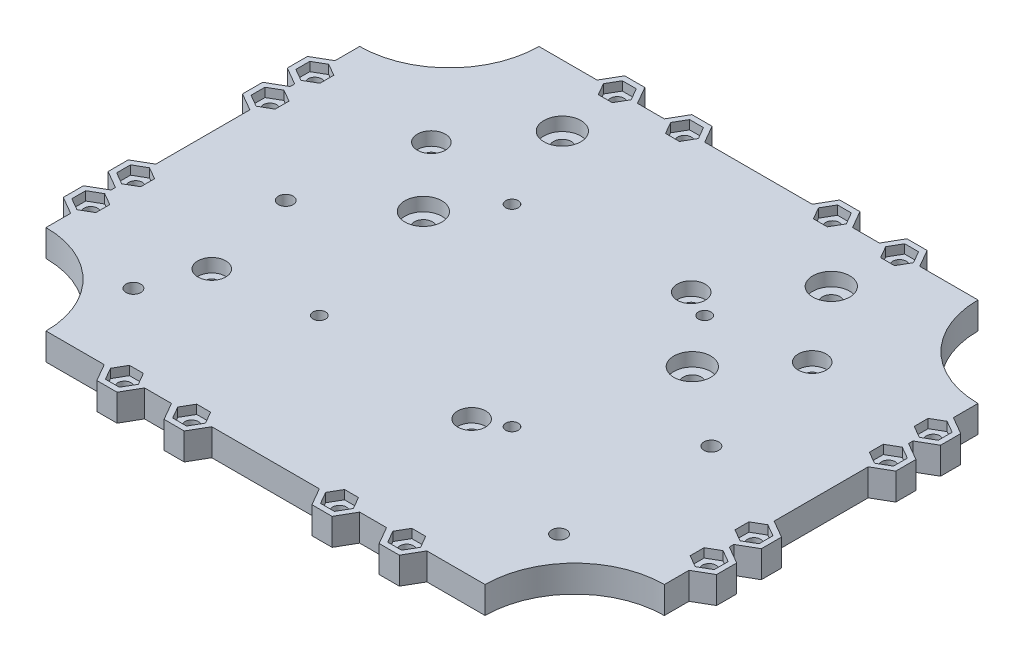
from build123d import *
from build123d.topology import SkipClean

# Parameters (mm, degrees)
SALIENTE_EXTRUIR2_DEPTH          = 6
CORTAR_EXTRUIR1_DEPTH            = 2
CORTAR_EXTRUIR2_DEPTH            = 2
CROQUIS5_R                       = 1.5
CORTAR_EXTRUIR3_DEPTH            = 2
CROQUIS7_R                       = 1.65
CORTAR_EXTRUIR4_DEPTH            = 10
CORTAR_EXTRUIR9_DEPTH            = 10
S_LIDO_MOVER_COPIAR1_OUTLINE_R   = 1.5
S_LIDO_MOVER_COPIAR1_OUTLINE_R_2 = 1.65
S_LIDO_MOVER_COPIAR1_DEPTH       = 6
S_LIDO_MOVER_COPIAR1_2_OUTLINE_R = 1.5
S_LIDO_MOVER_COPIAR1_2_DEPTH     = 2
S_LIDO_MOVER_COPIAR1_START       = 4
S_LIDO_MOVER_COPIAR1_3_OUTLINE_R = 1.5
S_LIDO_MOVER_COPIAR1_3_DEPTH     = 2
S_LIDO_MOVER_COPIAR1_4_OUTLINE_W = 12
S_LIDO_MOVER_COPIAR1_4_OUTLINE_H = 110
S_LIDO_MOVER_COPIAR1_4_OUTLINE_R = 1.65
S_LIDO_MOVER_COPIAR1_4_DEPTH     = 6
S_LIDO_MOVER_COPIAR1_START_2     = 2
S_LIDO_MOVER_COPIAR1_5_DEPTH     = 2
CROQUIS9_R                       = 4.125
CORTAR_EXTRUIR10_DEPTH           = 3
CROQUIS10_R                      = 2
CORTAR_EXTRUIR11_DEPTH           = 4
CROQUIS12_R                      = 3.125
CORTAR_EXTRUIR12_DEPTH           = 3
CROQUIS13_R                      = 1.5
CORTAR_EXTRUIR13_DEPTH           = 3
CROQUIS14_R                      = 1.4
CORTAR_EXTRUIR14_DEPTH           = 13


# Read off the part's stored shape, not the designer's step: Sólido-Mover/Copiar1
with BuildPart() as part:
    # Croquis1 → Saliente-Extruir2 (new body)
    with BuildSketch(Plane(origin=(0, 0, 0), x_dir=(1, 0, 0), z_dir=(0, 1, 0))):
        with BuildLine():
            Line((75, 20.5), (75, 29.5))
            Line((75, 29.5), (75, 35))
            ThreePointArc((75, 35), (60.857864376, 40.857864376), (55, 55))
            Line((55, 55), (42, 55))
            Line((42, 55), (33, 55))
            Line((33, 55), (27, 55))
            Line((27, 55), (18, 55))
            Line((18, 55), (0, 55))
            Line((0, 55), (-18, 55))
            Line((-18, 55), (-27, 55))
            Line((-27, 55), (-33, 55))
            Line((-33, 55), (-42, 55))
            Line((-42, 55), (-55, 55))
            ThreePointArc((-55, 55), (-60.857864376, 40.857864376), (-75, 35))
            Line((-75, 35), (-75, 29.5))
            Line((-75, 29.5), (-75, 20.5))
            Line((-75, 20.5), (-75, 19.5))
            Line((-75, 19.5), (-75, 10.5))
            Line((-75, 10.5), (-75, 0))
            Line((-75, 0), (-75, -10.5))
            Line((-75, -10.5), (-75, -19.5))
            Line((-75, -19.5), (-75, -20.5))
            Line((-75, -20.5), (-75, -29.5))
            Line((-75, -29.5), (-75, -35))
            ThreePointArc((-75, -35), (-60.857864376, -40.857864376), (-55, -55))
            Line((-55, -55), (-42, -55))
            Line((-42, -55), (-33, -55))
            Line((-33, -55), (-27, -55))
            Line((-27, -55), (-18, -55))
            Line((-18, -55), (0, -55))
            Line((0, -55), (18, -55))
            Line((18, -55), (27, -55))
            Line((27, -55), (33, -55))
            Line((33, -55), (42, -55))
            Line((42, -55), (55, -55))
            ThreePointArc((55, -55), (60.857864376, -40.857864376), (75, -35))
            Line((75, -35), (75, -29.5))
            Line((75, -29.5), (75, -20.5))
            Line((75, -20.5), (75, -19.5))
            Line((75, -19.5), (75, -10.5))
            Line((75, -10.5), (75, 0))
            Line((75, 0), (75, 10.5))
            Line((75, 10.5), (75, 19.5))
            Line((75, 19.5), (75, 20.5))
        make_face()
        Polygon((-39.75, 58.897114317), (-42, 55), (-33, 55), (-35.25, 58.897114317), align=None)
        Polygon((-24.75, 58.897114317), (-27, 55), (-18, 55), (-20.25, 58.897114317), align=None)
        Polygon((27, 55), (18, 55), (20.25, 58.897114317), (24.75, 58.897114317), align=None)
        Polygon((42, 55), (33, 55), (35.25, 58.897114317), (39.75, 58.897114317), align=None)
        Polygon((75, 20.5), (75, 29.5), (78.897114317, 27.25), (78.897114317, 22.75), align=None)
        Polygon((75, 10.5), (75, 19.5), (78.897114317, 17.25), (78.897114317, 12.75), align=None)
        Polygon((78.897114317, -12.75), (75, -10.5), (75, -19.5), (78.897114317, -17.25), align=None)
        Polygon((78.897114317, -22.75), (75, -20.5), (75, -29.5), (78.897114317, -27.25), align=None)
        Polygon((39.75, -58.897114317), (42, -55), (33, -55), (35.25, -58.897114317), align=None)
        Polygon((24.75, -58.897114317), (27, -55), (18, -55), (20.25, -58.897114317), align=None)
        Polygon((-42, -55), (-33, -55), (-35.25, -58.897114317), (-39.75, -58.897114317), align=None)
        Polygon((-18, -55), (-20.25, -58.897114317), (-24.75, -58.897114317), (-27, -55), align=None)
        Polygon((-75, -29.5), (-78.897114317, -27.25), (-78.897114317, -22.75), (-75, -20.5), align=None)
        Polygon((-75, -19.5), (-78.897114317, -17.25), (-78.897114317, -12.75), (-75, -10.5), align=None)
        Polygon((-78.897114317, 12.75), (-75, 10.5), (-75, 19.5), (-78.897114317, 17.25), align=None)
        Polygon((-78.897114317, 22.75), (-75, 20.5), (-75, 29.5), (-78.897114317, 27.25), align=None)
    extrude(amount=SALIENTE_EXTRUIR2_DEPTH)

    # Croquis2 → Cortar-Extruir1 (cut)
    with BuildSketch(Plane(origin=(0, 6, 0), x_dir=(1, 0, 0), z_dir=(0, 1, 0))):
        Polygon((-34.4, 55), (-35.95, 57.684678752), (-39.05, 57.684678752), (-40.6, 55), (-39.05, 52.315321248), (-35.95, 52.315321248), align=None)
        Polygon((-19.4, 55), (-20.95, 57.684678752), (-24.05, 57.684678752), (-25.6, 55), (-24.05, 52.315321248), (-20.95, 52.315321248), align=None)
        Polygon((20.95, 52.315321248), (19.4, 55), (20.95, 57.684678752), (24.05, 57.684678752), (25.6, 55), (24.05, 52.315321248), align=None)
        Polygon((35.95, 52.315321248), (34.4, 55), (35.95, 57.684678752), (39.05, 57.684678752), (40.6, 55), (39.05, 52.315321248), align=None)
        Polygon((39.05, -52.315321248), (35.95, -52.315321248), (34.4, -55), (35.95, -57.684678752), (39.05, -57.684678752), (40.6, -55), align=None)
        Polygon((24.05, -52.315321248), (20.95, -52.315321248), (19.4, -55), (20.95, -57.684678752), (24.05, -57.684678752), (25.6, -55), align=None)
        Polygon((-20.95, -52.315321248), (-19.4, -55), (-20.95, -57.684678752), (-24.05, -57.684678752), (-25.6, -55), (-24.05, -52.315321248), align=None)
        Polygon((-35.95, -52.315321248), (-34.4, -55), (-35.95, -57.684678752), (-39.05, -57.684678752), (-40.6, -55), (-39.05, -52.315321248), align=None)
        Polygon((75, 21.9), (77.684678752, 23.45), (77.684678752, 26.55), (75, 28.1), (72.315321248, 26.55), (72.315321248, 23.45), align=None)
        Polygon((-72.315321248, 23.45), (-75, 21.9), (-77.684678752, 23.45), (-77.684678752, 26.55), (-75, 28.1), (-72.315321248, 26.55), align=None)
        Polygon((75, 11.9), (77.684678752, 13.45), (77.684678752, 16.55), (75, 18.1), (72.315321248, 16.55), (72.315321248, 13.45), align=None)
        Polygon((-72.315321248, 13.45), (-75, 11.9), (-77.684678752, 13.45), (-77.684678752, 16.55), (-75, 18.1), (-72.315321248, 16.55), align=None)
        Polygon((72.315321248, -13.45), (75, -11.9), (77.684678752, -13.45), (77.684678752, -16.55), (75, -18.1), (72.315321248, -16.55), align=None)
        Polygon((72.315321248, -23.45), (75, -21.9), (77.684678752, -23.45), (77.684678752, -26.55), (75, -28.1), (72.315321248, -26.55), align=None)
        Polygon((-72.315321248, -16.55), (-72.315321248, -13.45), (-75, -11.9), (-77.684678752, -13.45), (-77.684678752, -16.55), (-75, -18.1), align=None)
        Polygon((-72.315321248, -26.55), (-72.315321248, -23.45), (-75, -21.9), (-77.684678752, -23.45), (-77.684678752, -26.55), (-75, -28.1), align=None)
    extrude(amount=-CORTAR_EXTRUIR1_DEPTH, mode=Mode.SUBTRACT)

    # Croquis3 → Cortar-Extruir2 (cut)
    with BuildSketch(Plane.XZ):
        Polygon((-34.4, 55), (-35.95, 57.684678752), (-39.05, 57.684678752), (-40.6, 55), (-39.05, 52.315321248), (-35.95, 52.315321248), align=None)
        Polygon((-19.4, 55), (-20.95, 57.684678752), (-24.05, 57.684678752), (-25.6, 55), (-24.05, 52.315321248), (-20.95, 52.315321248), align=None)
        Polygon((-35.95, -52.315321248), (-34.4, -55), (-35.95, -57.684678752), (-39.05, -57.684678752), (-40.6, -55), (-39.05, -52.315321248), align=None)
        Polygon((-20.95, -52.315321248), (-19.4, -55), (-20.95, -57.684678752), (-24.05, -57.684678752), (-25.6, -55), (-24.05, -52.315321248), align=None)
        Polygon((24.05, -52.315321248), (20.95, -52.315321248), (19.4, -55), (20.95, -57.684678752), (24.05, -57.684678752), (25.6, -55), align=None)
        Polygon((39.05, -52.315321248), (35.95, -52.315321248), (34.4, -55), (35.95, -57.684678752), (39.05, -57.684678752), (40.6, -55), align=None)
        Polygon((20.95, 52.315321248), (19.4, 55), (20.95, 57.684678752), (24.05, 57.684678752), (25.6, 55), (24.05, 52.315321248), align=None)
        Polygon((35.95, 52.315321248), (34.4, 55), (35.95, 57.684678752), (39.05, 57.684678752), (40.6, 55), (39.05, 52.315321248), align=None)
        Polygon((75, 21.9), (77.684678752, 23.45), (77.684678752, 26.55), (75, 28.1), (72.315321248, 26.55), (72.315321248, 23.45), align=None)
        Polygon((72.315321248, -23.45), (75, -21.9), (77.684678752, -23.45), (77.684678752, -26.55), (75, -28.1), (72.315321248, -26.55), align=None)
        Polygon((75, 11.9), (77.684678752, 13.45), (77.684678752, 16.55), (75, 18.1), (72.315321248, 16.55), (72.315321248, 13.45), align=None)
        Polygon((72.315321248, -13.45), (75, -11.9), (77.684678752, -13.45), (77.684678752, -16.55), (75, -18.1), (72.315321248, -16.55), align=None)
        Polygon((-72.315321248, -16.55), (-72.315321248, -13.45), (-75, -11.9), (-77.684678752, -13.45), (-77.684678752, -16.55), (-75, -18.1), align=None)
        Polygon((-72.315321248, -26.55), (-72.315321248, -23.45), (-75, -21.9), (-77.684678752, -23.45), (-77.684678752, -26.55), (-75, -28.1), align=None)
        Polygon((-72.315321248, 13.45), (-75, 11.9), (-77.684678752, 13.45), (-77.684678752, 16.55), (-75, 18.1), (-72.315321248, 16.55), align=None)
        Polygon((-72.315321248, 23.45), (-75, 21.9), (-77.684678752, 23.45), (-77.684678752, 26.55), (-75, 28.1), (-72.315321248, 26.55), align=None)
    extrude(amount=-CORTAR_EXTRUIR2_DEPTH, mode=Mode.SUBTRACT)

    # Croquis5 → Cortar-Extruir3 (cut)
    with BuildSketch(Plane(origin=(0, 4, 0), x_dir=(1, 0, 0), z_dir=(0, 1, 0))):
        with Locations(Location((-37.5, 55, 0), (0, 0, 270))):
            Circle(CROQUIS5_R)
        with Locations(Location((-22.5, 55, 0), (0, 0, 270))):
            Circle(CROQUIS5_R)
        with Locations(Location((22.5, 55, 0), (0, 0, 90))):
            Circle(CROQUIS5_R)
        with Locations(Location((37.5, 55, 0), (0, 0, 90))):
            Circle(CROQUIS5_R)
        with Locations(Location((22.5, -55, 0), (0, 0, 270))):
            Circle(CROQUIS5_R)
        with Locations(Location((37.5, -55, 0), (0, 0, 270))):
            Circle(CROQUIS5_R)
        with Locations(Location((-22.5, -55, 0), (0, 0, 90))):
            Circle(CROQUIS5_R)
        with Locations(Location((-37.5, -55, 0), (0, 0, 90))):
            Circle(CROQUIS5_R)
        with Locations(Location((75, 25, 0), (0, 0, 270))):
            Circle(CROQUIS5_R)
        with Locations(Location((75, 15, 0), (0, 0, 270))):
            Circle(CROQUIS5_R)
        with Locations(Location((75, -15, 0), (0, 0, 90))):
            Circle(CROQUIS5_R)
        with Locations(Location((75, -25, 0), (0, 0, 90))):
            Circle(CROQUIS5_R)
        with Locations(Location((-75, -25, 0), (0, 0, 270))):
            Circle(CROQUIS5_R)
        with Locations(Location((-75, -15, 0), (0, 0, 270))):
            Circle(CROQUIS5_R)
        with Locations(Location((-75, 15, 0), (0, 0, 90))):
            Circle(CROQUIS5_R)
        with Locations(Location((-75, 25, 0), (0, 0, 90))):
            Circle(CROQUIS5_R)
    extrude(amount=-CORTAR_EXTRUIR3_DEPTH, mode=Mode.SUBTRACT)

    # Croquis7 → Cortar-Extruir4 (cut)
    with BuildSketch(Plane(origin=(0, 6, 0), x_dir=(1, 0, 0), z_dir=(0, 1, 0))):
        with Locations(Location((-53.5, -37, 0), (0, 0, 270))):
            Circle(CROQUIS7_R)
        with Locations(Location((-53.5, -3, 0), (0, 0, 270))):
            Circle(CROQUIS7_R)
        with Locations(Location((53.5, -37, 0), (0, 0, 270))):
            Circle(CROQUIS7_R)
        with Locations(Location((53.5, -3, 0), (0, 0, 270))):
            Circle(CROQUIS7_R)
    extrude(amount=-CORTAR_EXTRUIR4_DEPTH, mode=Mode.SUBTRACT)

    # Croquis8 → Cortar-Extruir9 (cut)
    with BuildSketch(Plane(origin=(0, 6, 0), x_dir=(1, 0, 0), z_dir=(0, 1, 0))):
        Polygon((0, 55), (6, 55), (6, -55), (-6, -55), (-6, 55), align=None)
    extrude(amount=-CORTAR_EXTRUIR9_DEPTH, mode=Mode.SUBTRACT)


with BuildPart() as cortar_extruir9_piece_1:
    # of the separate pieces the step leaves, piece 1, a body of its own (cortar_extruir9_pieces)
    add(part.part.solids().sort_by_distance((75, 0, 35))[0])

    # Sólido-Mover/Copiar1 outline → Sólido-Mover/Copiar1 (cut)
    # profile 1 of 15: a face of its own
    with BuildSketch(Plane(origin=(0, 0, 0), x_dir=(1, 0, 0), z_dir=(0, 1, 0))):
        with BuildLine():
            ThreePointArc((12, -55), (10.5, -53.5), (9, -55))
            Line((9, -55), (12, -55))
        make_face()
    # profile 2 of 15: a face of its own
    with BuildSketch(Plane(origin=(0, 0, 0), x_dir=(1, 0, 0), z_dir=(0, 1, 0))):
        with BuildLine():
            Line((12, 55), (9, 55))
            ThreePointArc((9, 55), (10.5, 53.5), (12, 55))
        make_face()
    # profile 3 of 15: a face of its own
    with BuildSketch(Plane(origin=(0, 0, 0), x_dir=(1, 0, 0), z_dir=(0, 1, 0))):
        with BuildLine():
            Line((18, -55), (20.25, -58.897114317))
            Line((20.25, -58.897114317), (23.25, -58.897114317))
            Line((23.25, -58.897114317), (21.75, -56.299038106))
            ThreePointArc((21.75, -56.299038106), (21.200961894, -55.75), (21, -55))
            Line((21, -55), (18, -55))
        make_face()
    # profile 4 of 15: a face of its own
    with BuildSketch(Plane(origin=(0, 0, 0), x_dir=(1, 0, 0), z_dir=(0, 1, 0))):
        with BuildLine():
            Line((20.25, 58.897114317), (18, 55))
            Line((18, 55), (21, 55))
            ThreePointArc((21, 55), (21.200961894, 55.75), (21.75, 56.299038106))
            Line((21.75, 56.299038106), (23.25, 58.897114317))
            Line((23.25, 58.897114317), (20.25, 58.897114317))
        make_face()
    # profile 5 of 15: a face of its own
    with BuildSketch(Plane(origin=(0, 0, 0), x_dir=(1, 0, 0), z_dir=(0, 1, 0))):
        with BuildLine():
            Line((26.25, -56.299038106), (27, -55))
            ThreePointArc((27, -55), (24.200961894, -54.25), (26.25, -56.299038106))
        make_face()
    # profile 6 of 15: a face of its own
    with BuildSketch(Plane(origin=(0, 0, 0), x_dir=(1, 0, 0), z_dir=(0, 1, 0))):
        with BuildLine():
            Line((27, 55), (26.25, 56.299038106))
            ThreePointArc((26.25, 56.299038106), (24.200961894, 54.25), (27, 55))
        make_face()
    # profile 7 of 15: a face of its own
    with BuildSketch(Plane(origin=(0, 0, 0), x_dir=(1, 0, 0), z_dir=(0, 1, 0))):
        with BuildLine():
            Line((33, -55), (35.25, -58.897114317))
            Line((35.25, -58.897114317), (39.75, -58.897114317))
            Line((39.75, -58.897114317), (42, -55))
            Line((42, -55), (39, -55))
            ThreePointArc((39, -55), (37.5, -56.5), (36, -55))
            Line((36, -55), (33, -55))
        make_face()
    # profile 8 of 15: a face of its own
    with BuildSketch(Plane(origin=(0, 0, 0), x_dir=(1, 0, 0), z_dir=(0, 1, 0))):
        with BuildLine():
            Line((35.25, 58.897114317), (33, 55))
            Line((33, 55), (36, 55))
            ThreePointArc((36, 55), (37.5, 56.5), (39, 55))
            Line((39, 55), (42, 55))
            Line((42, 55), (39.75, 58.897114317))
            Line((39.75, 58.897114317), (35.25, 58.897114317))
        make_face()
    # profile 9 of 15: a face of its own
    with BuildSketch(Plane(origin=(0, 0, 0), x_dir=(1, 0, 0), z_dir=(0, 1, 0))):
        with BuildLine():
            ThreePointArc((52.282739333, -38.113901463), (45.473659633, -45.365302634), (43, -55))
            Line((43, -55), (55, -55))
            ThreePointArc((55, -55), (60.857864376, -40.857864376), (75, -35))
            Line((75, -35), (75, -29.5))
            Line((75, -29.5), (78.897114317, -27.25))
            Line((78.897114317, -27.25), (78.897114317, -22.75))
            Line((78.897114317, -22.75), (75, -20.5))
            Line((75, -20.5), (75, -19.5))
            Line((75, -19.5), (78.897114317, -17.25))
            Line((78.897114317, -17.25), (78.897114317, -12.75))
            Line((78.897114317, -12.75), (75, -10.5))
            Line((75, -10.5), (75, 10.5))
            Line((75, 10.5), (78.897114317, 12.75))
            Line((78.897114317, 12.75), (78.897114317, 17.25))
            Line((78.897114317, 17.25), (75, 19.5))
            Line((75, 19.5), (75, 20.5))
            Line((75, 20.5), (78.897114317, 22.75))
            Line((78.897114317, 22.75), (78.897114317, 27.25))
            Line((78.897114317, 27.25), (75, 29.5))
            Line((75, 29.5), (75, 35))
            ThreePointArc((75, 35), (60.857864376, 40.857864376), (55, 55))
            Line((55, 55), (43, 55))
            ThreePointArc((43, 55), (48.857864376, 40.857864376), (63, 35))
            Line((63, 35), (63, 29.5))
            Line((63, 29.5), (66.897114317, 27.25))
            Line((66.897114317, 27.25), (66.897114317, 22.75))
            Line((66.897114317, 22.75), (63, 20.5))
            Line((63, 20.5), (63, 19.5))
            Line((63, 19.5), (66.897114317, 17.25))
            Line((66.897114317, 17.25), (66.897114317, 12.75))
            Line((66.897114317, 12.75), (63, 10.5))
            Line((63, 10.5), (63, -10.5))
            Line((63, -10.5), (66.897114317, -12.75))
            Line((66.897114317, -12.75), (66.897114317, -17.25))
            Line((66.897114317, -17.25), (63, -19.5))
            Line((63, -19.5), (63, -20.5))
            Line((63, -20.5), (66.897114317, -22.75))
            Line((66.897114317, -22.75), (66.897114317, -27.25))
            Line((66.897114317, -27.25), (63, -29.5))
            Line((63, -29.5), (63, -35))
            ThreePointArc((63, -35), (58.970622907, -35.410101576), (55.106491204, -36.623587975))
            ThreePointArc((55.106491204, -36.623587975), (54.270151722, -38.459234842), (52.282739333, -38.113901463))
        make_face()
        with Locations((75, -25)):
            Circle(S_LIDO_MOVER_COPIAR1_OUTLINE_R, mode=Mode.SUBTRACT)
        with Locations((75, -15)):
            Circle(S_LIDO_MOVER_COPIAR1_OUTLINE_R, mode=Mode.SUBTRACT)
        with Locations((75, 15)):
            Circle(S_LIDO_MOVER_COPIAR1_OUTLINE_R, mode=Mode.SUBTRACT)
        with Locations((75, 25)):
            Circle(S_LIDO_MOVER_COPIAR1_OUTLINE_R, mode=Mode.SUBTRACT)
    # profile 10 of 15: a face of its own
    with BuildSketch(Plane(origin=(0, 0, 0), x_dir=(1, 0, 0), z_dir=(0, 1, 0))):
        with Locations((63, -25)):
            Circle(S_LIDO_MOVER_COPIAR1_OUTLINE_R)
    # profile 11 of 15: a face of its own
    with BuildSketch(Plane(origin=(0, 0, 0), x_dir=(1, 0, 0), z_dir=(0, 1, 0))):
        with Locations((63, 25)):
            Circle(S_LIDO_MOVER_COPIAR1_OUTLINE_R)
    # profile 12 of 15: a face of its own
    with BuildSketch(Plane(origin=(0, 0, 0), x_dir=(1, 0, 0), z_dir=(0, 1, 0))):
        with Locations((63, -15)):
            Circle(S_LIDO_MOVER_COPIAR1_OUTLINE_R)
    # profile 13 of 15: a face of its own
    with BuildSketch(Plane(origin=(0, 0, 0), x_dir=(1, 0, 0), z_dir=(0, 1, 0))):
        with Locations((63, 15)):
            Circle(S_LIDO_MOVER_COPIAR1_OUTLINE_R)
    # profile 14 of 15: a face of its own
    with BuildSketch(Plane(origin=(0, 0, 0), x_dir=(1, 0, 0), z_dir=(0, 1, 0))):
        with Locations((41.5, -37)):
            Circle(S_LIDO_MOVER_COPIAR1_OUTLINE_R_2)
    # profile 15 of 15: a face of its own
    with BuildSketch(Plane(origin=(0, 0, 0), x_dir=(1, 0, 0), z_dir=(0, 1, 0))):
        with Locations((41.5, -3)):
            Circle(S_LIDO_MOVER_COPIAR1_OUTLINE_R_2)
    extrude(amount=S_LIDO_MOVER_COPIAR1_DEPTH, mode=Mode.SUBTRACT)

    # S_lido-Mover_Copiar1 2 outline → S_lido-Mover_Copiar1 2 (cut)
    # profile 1 of 10: a face of its own
    with BuildSketch(Plane(origin=(0, 0, 0), x_dir=(1, 0, 0), z_dir=(0, 1, 0))):
        with BuildLine():
            Line((8.95, -52.315321248), (7.4, -55))
            Line((7.4, -55), (9, -55))
            ThreePointArc((9, -55), (10.5, -53.5), (12, -55))
            Line((12, -55), (13.6, -55))
            Line((13.6, -55), (12.05, -52.315321248))
            Line((12.05, -52.315321248), (8.95, -52.315321248))
        make_face()
    # profile 2 of 10: a face of its own
    with BuildSketch(Plane(origin=(0, 0, 0), x_dir=(1, 0, 0), z_dir=(0, 1, 0))):
        with BuildLine():
            Line((9, 55), (7.4, 55))
            Line((7.4, 55), (8.95, 52.315321248))
            Line((8.95, 52.315321248), (12.05, 52.315321248))
            Line((12.05, 52.315321248), (13.6, 55))
            Line((13.6, 55), (12, 55))
            ThreePointArc((12, 55), (10.5, 53.5), (9, 55))
        make_face()
    # profile 3 of 10: a face of its own
    with BuildSketch(Plane(origin=(0, 0, 0), x_dir=(1, 0, 0), z_dir=(0, 1, 0))):
        with BuildLine():
            Line((27.05, -52.315321248), (24.05, -52.315321248))
            Line((24.05, -52.315321248), (24.826251043, -53.659827495))
            ThreePointArc((24.826251043, -53.659827495), (26.287202822, -53.723163394), (27, -55))
            Line((27, -55), (28.6, -55))
            Line((28.6, -55), (27.05, -52.315321248))
        make_face()
    # profile 4 of 10: a face of its own
    with BuildSketch(Plane(origin=(0, 0, 0), x_dir=(1, 0, 0), z_dir=(0, 1, 0))):
        with BuildLine():
            Line((24.05, -57.684678752), (25.45, -57.684678752))
            Line((25.45, -57.684678752), (26.25, -56.299038106))
            ThreePointArc((26.25, -56.299038106), (25.543319339, -56.499374348), (24.826251043, -56.340172505))
            Line((24.826251043, -56.340172505), (24.05, -57.684678752))
        make_face()
    # profile 5 of 10: a face of its own
    with BuildSketch(Plane(origin=(0, 0, 0), x_dir=(1, 0, 0), z_dir=(0, 1, 0))):
        with BuildLine():
            Line((24.826251043, 53.659827495), (24.05, 52.315321248))
            Line((24.05, 52.315321248), (27.05, 52.315321248))
            Line((27.05, 52.315321248), (28.6, 55))
            Line((28.6, 55), (27, 55))
            ThreePointArc((27, 55), (26.287202822, 53.723163394), (24.826251043, 53.659827495))
        make_face()
    # profile 6 of 10: a face of its own
    with BuildSketch(Plane(origin=(0, 0, 0), x_dir=(1, 0, 0), z_dir=(0, 1, 0))):
        with BuildLine():
            Line((26.25, 56.299038106), (25.45, 57.684678752))
            Line((25.45, 57.684678752), (24.05, 57.684678752))
            Line((24.05, 57.684678752), (24.826251043, 56.340172505))
            ThreePointArc((24.826251043, 56.340172505), (25.543319339, 56.499374348), (26.25, 56.299038106))
        make_face()
    # profile 7 of 10: a face of its own
    with BuildSketch(Plane(origin=(0, 0, 0), x_dir=(1, 0, 0), z_dir=(0, 1, 0))):
        Polygon((63, -11.9), (60.315321248, -13.45), (60.315321248, -16.55), (63, -18.1), (65.684678752, -16.55), (65.684678752, -13.45), align=None)
        with Locations((63, -15)):
            Circle(S_LIDO_MOVER_COPIAR1_2_OUTLINE_R, mode=Mode.SUBTRACT)
    # profile 8 of 10: a face of its own
    with BuildSketch(Plane(origin=(0, 0, 0), x_dir=(1, 0, 0), z_dir=(0, 1, 0))):
        Polygon((63, 18.1), (60.315321248, 16.55), (60.315321248, 13.45), (63, 11.9), (65.684678752, 13.45), (65.684678752, 16.55), align=None)
        with Locations((63, 15)):
            Circle(S_LIDO_MOVER_COPIAR1_2_OUTLINE_R, mode=Mode.SUBTRACT)
    # profile 9 of 10: a face of its own
    with BuildSketch(Plane(origin=(0, 0, 0), x_dir=(1, 0, 0), z_dir=(0, 1, 0))):
        Polygon((63, -21.9), (60.315321248, -23.45), (60.315321248, -26.55), (63, -28.1), (65.684678752, -26.55), (65.684678752, -23.45), align=None)
        with Locations((63, -25)):
            Circle(S_LIDO_MOVER_COPIAR1_2_OUTLINE_R, mode=Mode.SUBTRACT)
    # profile 10 of 10: a face of its own
    with BuildSketch(Plane(origin=(0, 0, 0), x_dir=(1, 0, 0), z_dir=(0, 1, 0))):
        Polygon((63, 28.1), (60.315321248, 26.55), (60.315321248, 23.45), (63, 21.9), (65.684678752, 23.45), (65.684678752, 26.55), align=None)
        with Locations((63, 25)):
            Circle(S_LIDO_MOVER_COPIAR1_2_OUTLINE_R, mode=Mode.SUBTRACT)
    extrude(amount=S_LIDO_MOVER_COPIAR1_2_DEPTH, mode=Mode.SUBTRACT)

    # S_lido-Mover_Copiar1 3 outline → S_lido-Mover_Copiar1 3 (cut)
    # profile 1 of 10: a face of its own
    with BuildSketch(Plane(origin=(0, 0, 0), x_dir=(1, 0, 0), z_dir=(0, 1, 0)).offset(S_LIDO_MOVER_COPIAR1_START)):
        with BuildLine():
            Line((8.95, -52.315321248), (7.4, -55))
            Line((7.4, -55), (9, -55))
            ThreePointArc((9, -55), (10.5, -53.5), (12, -55))
            Line((12, -55), (13.6, -55))
            Line((13.6, -55), (12.05, -52.315321248))
            Line((12.05, -52.315321248), (8.95, -52.315321248))
        make_face()
    # profile 2 of 10: a face of its own
    with BuildSketch(Plane(origin=(0, 0, 0), x_dir=(1, 0, 0), z_dir=(0, 1, 0)).offset(S_LIDO_MOVER_COPIAR1_START)):
        with BuildLine():
            Line((9, 55), (7.4, 55))
            Line((7.4, 55), (8.95, 52.315321248))
            Line((8.95, 52.315321248), (12.05, 52.315321248))
            Line((12.05, 52.315321248), (13.6, 55))
            Line((13.6, 55), (12, 55))
            ThreePointArc((12, 55), (10.5, 53.5), (9, 55))
        make_face()
    # profile 3 of 10: a face of its own
    with BuildSketch(Plane(origin=(0, 0, 0), x_dir=(1, 0, 0), z_dir=(0, 1, 0)).offset(S_LIDO_MOVER_COPIAR1_START)):
        with BuildLine():
            Line((27.05, -52.315321248), (24.05, -52.315321248))
            Line((24.05, -52.315321248), (24.826251043, -53.659827495))
            ThreePointArc((24.826251043, -53.659827495), (26.287202822, -53.723163394), (27, -55))
            Line((27, -55), (28.6, -55))
            Line((28.6, -55), (27.05, -52.315321248))
        make_face()
    # profile 4 of 10: a face of its own
    with BuildSketch(Plane(origin=(0, 0, 0), x_dir=(1, 0, 0), z_dir=(0, 1, 0)).offset(S_LIDO_MOVER_COPIAR1_START)):
        with BuildLine():
            Line((24.05, -57.684678752), (25.45, -57.684678752))
            Line((25.45, -57.684678752), (26.25, -56.299038106))
            ThreePointArc((26.25, -56.299038106), (25.543319339, -56.499374348), (24.826251043, -56.340172505))
            Line((24.826251043, -56.340172505), (24.05, -57.684678752))
        make_face()
    # profile 5 of 10: a face of its own
    with BuildSketch(Plane(origin=(0, 0, 0), x_dir=(1, 0, 0), z_dir=(0, 1, 0)).offset(S_LIDO_MOVER_COPIAR1_START)):
        with BuildLine():
            Line((24.826251043, 53.659827495), (24.05, 52.315321248))
            Line((24.05, 52.315321248), (27.05, 52.315321248))
            Line((27.05, 52.315321248), (28.6, 55))
            Line((28.6, 55), (27, 55))
            ThreePointArc((27, 55), (26.287202822, 53.723163394), (24.826251043, 53.659827495))
        make_face()
    # profile 6 of 10: a face of its own
    with BuildSketch(Plane(origin=(0, 0, 0), x_dir=(1, 0, 0), z_dir=(0, 1, 0)).offset(S_LIDO_MOVER_COPIAR1_START)):
        with BuildLine():
            Line((26.25, 56.299038106), (25.45, 57.684678752))
            Line((25.45, 57.684678752), (24.05, 57.684678752))
            Line((24.05, 57.684678752), (24.826251043, 56.340172505))
            ThreePointArc((24.826251043, 56.340172505), (25.543319339, 56.499374348), (26.25, 56.299038106))
        make_face()
    # profile 7 of 10: a face of its own
    with BuildSketch(Plane(origin=(0, 0, 0), x_dir=(1, 0, 0), z_dir=(0, 1, 0)).offset(S_LIDO_MOVER_COPIAR1_START)):
        Polygon((63, -11.9), (60.315321248, -13.45), (60.315321248, -16.55), (63, -18.1), (65.684678752, -16.55), (65.684678752, -13.45), align=None)
        with Locations((63, -15)):
            Circle(S_LIDO_MOVER_COPIAR1_3_OUTLINE_R, mode=Mode.SUBTRACT)
    # profile 8 of 10: a face of its own
    with BuildSketch(Plane(origin=(0, 0, 0), x_dir=(1, 0, 0), z_dir=(0, 1, 0)).offset(S_LIDO_MOVER_COPIAR1_START)):
        Polygon((63, 18.1), (60.315321248, 16.55), (60.315321248, 13.45), (63, 11.9), (65.684678752, 13.45), (65.684678752, 16.55), align=None)
        with Locations((63, 15)):
            Circle(S_LIDO_MOVER_COPIAR1_3_OUTLINE_R, mode=Mode.SUBTRACT)
    # profile 9 of 10: a face of its own
    with BuildSketch(Plane(origin=(0, 0, 0), x_dir=(1, 0, 0), z_dir=(0, 1, 0)).offset(S_LIDO_MOVER_COPIAR1_START)):
        Polygon((63, -21.9), (60.315321248, -23.45), (60.315321248, -26.55), (63, -28.1), (65.684678752, -26.55), (65.684678752, -23.45), align=None)
        with Locations((63, -25)):
            Circle(S_LIDO_MOVER_COPIAR1_3_OUTLINE_R, mode=Mode.SUBTRACT)
    # profile 10 of 10: a face of its own
    with BuildSketch(Plane(origin=(0, 0, 0), x_dir=(1, 0, 0), z_dir=(0, 1, 0)).offset(S_LIDO_MOVER_COPIAR1_START)):
        Polygon((63, 28.1), (60.315321248, 26.55), (60.315321248, 23.45), (63, 21.9), (65.684678752, 23.45), (65.684678752, 26.55), align=None)
        with Locations((63, 25)):
            Circle(S_LIDO_MOVER_COPIAR1_3_OUTLINE_R, mode=Mode.SUBTRACT)
    extrude(amount=S_LIDO_MOVER_COPIAR1_3_DEPTH, mode=Mode.SUBTRACT)

    # S_lido-Mover_Copiar1 4 outline → S_lido-Mover_Copiar1 4 (add)
    with BuildSketch(Plane(origin=(0, 0, 0), x_dir=(1, 0, 0), z_dir=(0, 1, 0))):
        Polygon((7.4, -55), (6, -55), (8.25, -58.897114317), (12.75, -58.897114317), (15, -55), (13.6, -55), (12.05, -57.684678752), (8.95, -57.684678752), align=None)
        Rectangle(S_LIDO_MOVER_COPIAR1_4_OUTLINE_W, S_LIDO_MOVER_COPIAR1_4_OUTLINE_H)
        Polygon((8.25, 58.897114317), (6, 55), (7.4, 55), (8.95, 57.684678752), (12.05, 57.684678752), (13.6, 55), (15, 55), (12.75, 58.897114317), align=None)
        Polygon((20.95, -52.315321248), (19.4, -55), (21, -55), (22.55, -57.684678752), (23.95, -57.684678752), (22.4, -55), (23.95, -52.315321248), align=None)
        Polygon((21, 55), (19.4, 55), (20.95, 52.315321248), (23.95, 52.315321248), (22.4, 55), (23.95, 57.684678752), (22.55, 57.684678752), align=None)
        Polygon((25.45, -57.684678752), (24.75, -58.897114317), (27.75, -58.897114317), (30, -55), (28.6, -55), (27.05, -57.684678752), align=None)
        Polygon((27.75, 58.897114317), (24.75, 58.897114317), (25.45, 57.684678752), (27.05, 57.684678752), (28.6, 55), (30, 55), align=None)
        Polygon((35.95, -52.315321248), (34.4, -55), (40.6, -55), (39.05, -52.315321248), align=None)
        Polygon((34.4, 55), (35.95, 52.315321248), (39.05, 52.315321248), (40.6, 55), align=None)
        with BuildLine():
            ThreePointArc((55.106491204, -36.623587975), (52.729848278, -35.540765158), (52.282739333, -38.113901463))
            ThreePointArc((52.282739333, -38.113901463), (53.664827609, -37.312304943), (55.106491204, -36.623587975))
        make_face()
        with Locations((53.5, -3)):
            Circle(S_LIDO_MOVER_COPIAR1_4_OUTLINE_R)
    extrude(amount=S_LIDO_MOVER_COPIAR1_4_DEPTH)

    # S_lido-Mover_Copiar1 5 outline → S_lido-Mover_Copiar1 5 (add)
    with SkipClean():  # the faces are left unmerged after this step: merging them gives an invalid solid
        with BuildSketch(Plane(origin=(0, 0, 0), x_dir=(1, 0, 0), z_dir=(0, 1, 0)).offset(S_LIDO_MOVER_COPIAR1_START_2)):
            with BuildLine():
                Line((9, -55), (7.4, -55))
                Line((7.4, -55), (8.95, -57.684678752))
                Line((8.95, -57.684678752), (12.05, -57.684678752))
                Line((12.05, -57.684678752), (13.6, -55))
                Line((13.6, -55), (12, -55))
                ThreePointArc((12, -55), (10.5, -56.5), (9, -55))
            make_face()
            with BuildLine():
                Line((8.95, 57.684678752), (7.4, 55))
                Line((7.4, 55), (9, 55))
                ThreePointArc((9, 55), (10.5, 56.5), (12, 55))
                Line((12, 55), (13.6, 55))
                Line((13.6, 55), (12.05, 57.684678752))
                Line((12.05, 57.684678752), (8.95, 57.684678752))
            make_face()
            with BuildLine():
                ThreePointArc((23.173748957, -56.340172505), (24, -55), (23.173748957, -53.659827495))
                Line((23.173748957, -53.659827495), (22.4, -55))
                Line((22.4, -55), (23.173748957, -56.340172505))
            make_face()
            with BuildLine():
                Line((26.25, -56.299038106), (25.45, -57.684678752))
                Line((25.45, -57.684678752), (27.05, -57.684678752))
                Line((27.05, -57.684678752), (28.6, -55))
                Line((28.6, -55), (27, -55))
                ThreePointArc((27, -55), (26.799038106, -55.75), (26.25, -56.299038106))
            make_face()
            with BuildLine():
                Line((22.4, 55), (23.173748957, 53.659827495))
                ThreePointArc((23.173748957, 53.659827495), (24, 55), (23.173748957, 56.340172505))
                Line((23.173748957, 56.340172505), (22.4, 55))
            make_face()
            with BuildLine():
                Line((27.05, 57.684678752), (25.45, 57.684678752))
                Line((25.45, 57.684678752), (26.25, 56.299038106))
                ThreePointArc((26.25, 56.299038106), (26.799038106, 55.75), (27, 55))
                Line((27, 55), (28.6, 55))
                Line((28.6, 55), (27.05, 57.684678752))
            make_face()
        extrude(amount=S_LIDO_MOVER_COPIAR1_5_DEPTH)


with BuildPart() as cortar_extruir9_piece_2:
    # of the separate pieces the step leaves, piece 2, a body of its own (cortar_extruir9_pieces)
    add(part.part.solids().sort_by_distance((-6, 0, 55))[0])

    # Combinar1: union Cortar-Extruir9 piece 1
    add(cortar_extruir9_piece_1.part)

    # Croquis9 → Cortar-Extruir10 (cut)
    with SkipClean():  # the faces are left unmerged after this step: merging them gives an invalid solid
        with BuildSketch(Plane(origin=(0, 6, 0), x_dir=(1, 0, 0), z_dir=(0, 1, 0))):
            with Locations(Location((24.01, 41.25, 0), (0, 0, 270))):
                Circle(CROQUIS9_R)
            with Locations(Location((-36.01, 10.23, 0), (0, 0, 270))):
                Circle(CROQUIS9_R)
            with Locations(Location((-36.01, 41.25, 0), (0, 0, 270))):
                Circle(CROQUIS9_R)
            with Locations(Location((24.01, 10.23, 0), (0, 0, 270))):
                Circle(CROQUIS9_R)
        extrude(amount=-CORTAR_EXTRUIR10_DEPTH, mode=Mode.SUBTRACT)

    # Croquis10 → Cortar-Extruir11 (cut)
    with SkipClean():  # the faces are left unmerged after this step: merging them gives an invalid solid
        with BuildSketch(Plane(origin=(0, 3, 0), x_dir=(1, 0, 0), z_dir=(0, 1, 0))):
            with Locations(Location((-36.01, 41.25, 0), (0, 0, 270))):
                Circle(CROQUIS10_R)
            with Locations(Location((24.01, 41.25, 0), (0, 0, 270))):
                Circle(CROQUIS10_R)
            with Locations(Location((24.01, 10.23, 0), (0, 0, 270))):
                Circle(CROQUIS10_R)
            with Locations(Location((-36.01, 10.23, 0), (0, 0, 270))):
                Circle(CROQUIS10_R)
        extrude(amount=-CORTAR_EXTRUIR11_DEPTH, mode=Mode.SUBTRACT)

    # Croquis12 → Cortar-Extruir12 (cut)
    with SkipClean():  # the faces are left unmerged after this step: merging them gives an invalid solid
        with BuildSketch(Plane(origin=(0, 6, 0), x_dir=(1, 0, 0), z_dir=(0, 1, 0))):
            with Locations(Location((-48.5, 24.5, 0), (0, 0, 270))):
                Circle(CROQUIS12_R)
            with Locations(Location((-48.5, -24.5, 0), (0, 0, 270))):
                Circle(CROQUIS12_R)
            with Locations(Location((9.5, 24.5, 0), (0, 0, 270))):
                Circle(CROQUIS12_R)
            with Locations(Location((9.5, -24.5, 0), (0, 0, 270))):
                Circle(CROQUIS12_R)
            with Locations(Location((36.5, 24.5, 0), (0, 0, 270))):
                Circle(CROQUIS12_R)
        extrude(amount=-CORTAR_EXTRUIR12_DEPTH, mode=Mode.SUBTRACT)

    # Croquis13 → Cortar-Extruir13 (cut)
    with SkipClean():  # the faces are left unmerged after this step: merging them gives an invalid solid
        with BuildSketch(Plane(origin=(0, 3, 0), x_dir=(1, 0, 0), z_dir=(0, 1, 0))):
            with Locations(Location((-48.5, 24.5, 0), (0, 0, 270))):
                Circle(CROQUIS13_R)
            with Locations(Location((-48.5, -24.5, 0), (0, 0, 270))):
                Circle(CROQUIS13_R)
            with Locations(Location((9.5, -24.5, 0), (0, 0, 270))):
                Circle(CROQUIS13_R)
            with Locations(Location((9.5, 24.5, 0), (0, 0, 270))):
                Circle(CROQUIS13_R)
            with Locations(Location((36.5, 24.5, 0), (0, 0, 270))):
                Circle(CROQUIS13_R)
        extrude(amount=-CORTAR_EXTRUIR13_DEPTH, mode=Mode.SUBTRACT)

    # Croquis14 → Cortar-Extruir14 (cut)
    with SkipClean():  # the faces are left unmerged after this step: merging them gives an invalid solid
        with BuildSketch(Plane(origin=(0, 6, 0), x_dir=(1, 0, 0), z_dir=(0, 1, 0))):
            with Locations(Location((15.5, 21.5, 0), (0, 0, 270))):
                Circle(CROQUIS14_R)
            with Locations(Location((15.5, -21.5, 0), (0, 0, 270))):
                Circle(CROQUIS14_R)
            with Locations(Location((-27.5, -21.5, 0), (0, 0, 270))):
                Circle(CROQUIS14_R)
            with Locations(Location((-27.5, 21.5, 0), (0, 0, 270))):
                Circle(CROQUIS14_R)
        extrude(amount=-CORTAR_EXTRUIR14_DEPTH, mode=Mode.SUBTRACT)


solid = cortar_extruir9_piece_2.part
